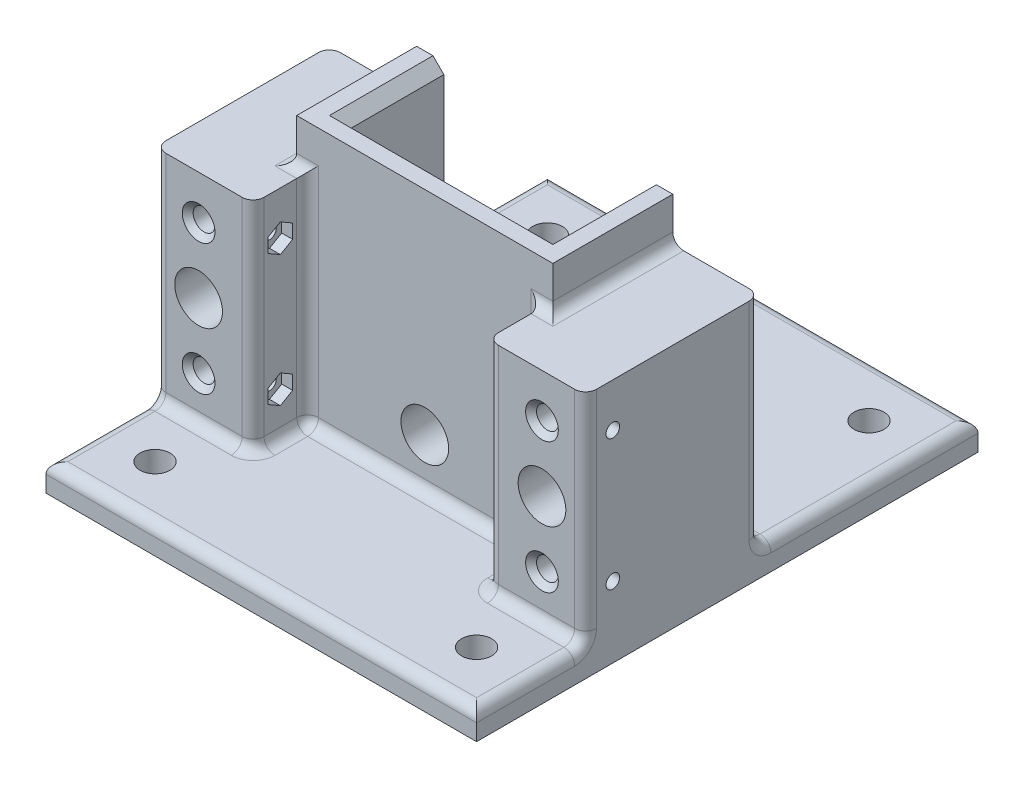
from build123d import *

# Parameters (mm, degrees)
EXTRUDE_1_DEPTH     = 30
SKETCH_2_W          = 10
SKETCH_2_H          = 40
EXTRUDE_2_DEPTH     = 2
SKETCH_3_W          = 32
SKETCH_3_H          = 40
EXTRUDE_3_DEPTH     = 16
SKETCH_4_R          = 4.375
CUT_EXTRUDE_1_DEPTH = 77.765877836
SKETCH_5_R          = 1.25
CUT_EXTRUDE_2_DEPTH = 59.386642308
SKETCH_6_R          = 2
CUT_EXTRUDE_3_DEPTH = 77.765877836
CUT_EXTRUDE_4_DEPTH = 2
CHAMFER_2_SIZE      = 3
CHAMFER_3_SIZE      = 1
CHAMFER_4_SIZE      = 3
EXTRUDE_4_DEPTH     = 18
SKETCH_10_R         = 4.375
CUT_EXTRUDE_5_DEPTH = 77.76587796
CHAMFER_6_SIZE      = 3
CHAMFER_7_SIZE      = 1
CHAMFER_8_SIZE      = 2
FILLET_3_R          = 2
SKETCH_12_W         = 79
SKETCH_12_H         = 72
EXTRUDE_5_DEPTH     = 5
FILLET_7_R          = 2
SKETCH_13_W         = 79
SKETCH_13_H         = 5
EXTRUDE_6_DEPTH     = 20
FILLET_10_R         = 2
FILLET_11_R         = 2
SKETCH_14_R         = 2.75
CUT_EXTRUDE_6_DEPTH = 101.583298875
CHAMFER_9_SIZE      = 1
CHAMFER_10_SIZE     = 2


with BuildPart() as part:
    # Эскиз1 → Бобышка-Вытянуть1 (new body)
    with BuildSketch(Plane(origin=(0, 0, 0), x_dir=(1, 0, 0), z_dir=(0, 1, 0))):
        Polygon((0, 0), (0, 22), (5, 22), (5, 5), (42, 5), (42, 22), (47, 22), (47, 0), align=None)
    extrude(amount=EXTRUDE_1_DEPTH)

    # Эскиз2 → Бобышка-Вытянуть2 (add)
    with BuildSketch(Plane(origin=(47, 0, 0), x_dir=(0, 0, -1), z_dir=(1, 0, 0))):
        with Locations((-5, 2)):
            Rectangle(SKETCH_2_W, SKETCH_2_H)
    extrude_2 = extrude(amount=-EXTRUDE_2_DEPTH)

    # Эскиз3 → Бобышка-Вытянуть3 (add)
    with BuildSketch(Plane(origin=(47, 0, 0), x_dir=(0, 0, -1), z_dir=(1, 0, 0))):
        with Locations((6, 2)):
            Rectangle(SKETCH_3_W, SKETCH_3_H)
    extrude_3 = extrude(amount=EXTRUDE_3_DEPTH)

    # Эскиз4 → Вырез-Вытянуть1 (cut, through all)
    with BuildSketch(Plane(origin=(0, 0, -22), x_dir=(-1, 0, 0), z_dir=(0, 0, -1))):
        with Locations((-55, 2)):
            Circle(SKETCH_4_R)
    cut_extrude_1 = extrude(amount=-CUT_EXTRUDE_1_DEPTH, mode=Mode.SUBTRACT)

    # Эскиз5 → Вырез-Вытянуть2 (cut, through all)
    with BuildSketch(Plane.ZY.offset(-45)):
        with Locations((5, 14)):
            Circle(SKETCH_5_R)
        with Locations(Location((5, -10, 0), (0, 0, 180))):
            Circle(SKETCH_5_R)
    cut_extrude_2 = extrude(amount=-CUT_EXTRUDE_2_DEPTH, mode=Mode.SUBTRACT)

    # Эскиз6 → Вырез-Вытянуть3 (cut, through all)
    with BuildSketch(Plane(origin=(0, 0, -22), x_dir=(-1, 0, 0), z_dir=(0, 0, -1))):
        with Locations((-55, 14)):
            Circle(SKETCH_6_R)
        with Locations((-55, -10)):
            Circle(SKETCH_6_R)
    cut_extrude_3 = extrude(amount=-CUT_EXTRUDE_3_DEPTH, mode=Mode.SUBTRACT)

    # Эскиз7 → Вырез-Вытянуть4 (cut)
    with BuildSketch(Plane.ZY.offset(-45)):
        Polygon((5, 11.401923789), (7.25, 12.700961894), (7.25, 15.299038106), (5, 16.598076211), (2.75, 15.299038106), (2.75, 12.700961894), align=None)
        Polygon((5, -7.401923789), (2.75, -8.700961894), (2.75, -11.299038106), (5, -12.598076211), (7.25, -11.299038106), (7.25, -8.700961894), align=None)
    cut_extrude_4 = extrude(amount=-CUT_EXTRUDE_4_DEPTH, mode=Mode.SUBTRACT)

    # Фаска2
    chamfer_2_edges = [part.edges().sort_by_distance(p)[0] for p in [
        (59.375, 2, -22),
    ]]
    chamfer(chamfer_2_edges, length=CHAMFER_2_SIZE)

    # Фаска3
    chamfer_3_edges = [part.edges().sort_by_distance(p)[0] for p in [
        (57, 14, -22),
        (57, -10, -22),
    ]]
    chamfer(chamfer_3_edges, length=CHAMFER_3_SIZE)

    # Зеркальное отражение2: Бобышка-Вытянуть2, Бобышка-Вытянуть3, Вырез-Вытянуть1, Вырез-Вытянуть2, Вырез-Вытянуть3, Вырез-Вытянуть4 across plane
    add(extrude_2.mirror(Plane(origin=(23.5, 0, 0), x_dir=(0, 0, 1), z_dir=(1, 0, 0))))
    add(extrude_3.mirror(Plane(origin=(23.5, 0, 0), x_dir=(0, 0, 1), z_dir=(1, 0, 0))))
    add(cut_extrude_1.mirror(Plane(origin=(23.5, 0, 0), x_dir=(0, 0, 1), z_dir=(1, 0, 0))), mode=Mode.SUBTRACT)
    add(cut_extrude_2.mirror(Plane(origin=(23.5, 0, 0), x_dir=(0, 0, 1), z_dir=(1, 0, 0))), mode=Mode.SUBTRACT)
    add(cut_extrude_3.mirror(Plane(origin=(23.5, 0, 0), x_dir=(0, 0, 1), z_dir=(1, 0, 0))), mode=Mode.SUBTRACT)
    add(cut_extrude_4.mirror(Plane(origin=(23.5, 0, 0), x_dir=(0, 0, 1), z_dir=(1, 0, 0))), mode=Mode.SUBTRACT)

    # Фаска4
    chamfer_4_edges = [part.edges().sort_by_distance(p)[0] for p in [
        (-12.375, 2, -22),
    ]]
    chamfer(chamfer_4_edges, length=CHAMFER_4_SIZE)

    # Эскиз9 → Бобышка-Вытянуть4 (add)
    with BuildSketch(Plane.XZ):
        Polygon((2, 0), (0, 0), (0, -22), (47, -22), (47, 0), (45, 0), align=None)
    extrude(amount=EXTRUDE_4_DEPTH)

    # Эскиз10 → Вырез-Вытянуть5 (cut, through all)
    with BuildSketch(Plane(origin=(0, 0, -22), x_dir=(-1, 0, 0), z_dir=(0, 0, -1))):
        with Locations((-23.5, -9)):
            Circle(SKETCH_10_R)
    extrude(amount=-CUT_EXTRUDE_5_DEPTH, mode=Mode.SUBTRACT)

    # Фаска6
    chamfer_6_edges = [part.edges().sort_by_distance(p)[0] for p in [
        (27.875, -9, -22),
    ]]
    chamfer(chamfer_6_edges, length=CHAMFER_6_SIZE)

    # Фаска7
    chamfer_7_edges = [part.edges().sort_by_distance(p)[0] for p in [
        (-10, 14, 10),
        (-10, -10, 10),
        (57, 14, 10),
        (57, -10, 10),
    ]]
    chamfer(chamfer_7_edges, length=CHAMFER_7_SIZE)

    # Фаска8
    chamfer_8_edges = [part.edges().sort_by_distance(p)[0] for p in [
        (5, 30, -13.5),
    ]]
    chamfer(chamfer_8_edges, length=CHAMFER_8_SIZE)

    # Скругление3
    fillet_3_edges = [part.edges().sort_by_distance(p)[0] for p in [
        (1, 22, 0),
        (2, 2, 0),
        (0, 22, -11),
        (45, 2, 0),
        (46, 22, 0),
        (47, 22, -11),
    ]]
    fillet(fillet_3_edges, radius=FILLET_3_R)

    # Эскиз12 → Бобышка-Вытянуть5 (add)
    with BuildSketch(Plane.XZ.offset(18)):
        with Locations((23.5, -26)):
            Rectangle(SKETCH_12_W, SKETCH_12_H)
    extrude(amount=EXTRUDE_5_DEPTH)

    # Скругление7
    fillet_7_edges = [part.edges().sort_by_distance(p)[0] for p in [
        (23.5, -18, -22),
    ]]
    fillet(fillet_7_edges, radius=FILLET_7_R)

    # Эскиз13 → Бобышка-Вытянуть6 (add)
    with BuildSketch(Plane.XY.offset(10)):
        with Locations((23.5, -20.5)):
            Rectangle(SKETCH_13_W, SKETCH_13_H)
    extrude(amount=EXTRUDE_6_DEPTH)

    # Скругление10
    fillet_10_edges = [part.edges().sort_by_distance(p)[0] for p in [
        (2, 2, 10),
        (2, -18, 6),
        (-16, 2, 10),
        (45, -18, 6),
        (45, 2, 10),
        (23.5, -18, 0),
        (44.414213562, -18, 0.585786438),
        (2.585786438, -18, 0.585786438),
        (-7, -18, 10),
        (54, -18, 10),
        (63, -18, 20),
        (-16, -18, 20),
        (23.5, -18, 30),
        (63, 2, 10),
    ]]
    fillet(fillet_10_edges, radius=FILLET_10_R)

    # Скругление11
    # the kernel refuses this fillet: 2 mm, written as the material it takes off along each edge
    with BuildSketch(Plane(origin=(63, -16, -22), x_dir=(-1, 0, 0), z_dir=(0, 1, 0)), Plane(origin=(63, -18, -24), x_dir=(0, -1, 0), z_dir=(0, 0, -1)), Plane(origin=(-16, -18, -67), x_dir=(0, -1, 0), z_dir=(0, 0, 1))) as fillet_11_piece_1:
        with BuildLine():
            CenterArc((FILLET_11_R, FILLET_11_R), FILLET_11_R, 180, 90)
            Line((0, FILLET_11_R), (0, 0))
            Line((0, 0), (FILLET_11_R, 0))
        make_face()
    extrude(amount=43, mode=Mode.SUBTRACT)
    with BuildSketch(Plane(origin=(-16, -16, -24), x_dir=(0, 0, 1), z_dir=(0, 1, 0))) as fillet_11_piece_2:
        with BuildLine():
            CenterArc((2 + FILLET_11_R, FILLET_11_R), FILLET_11_R, 180, 90)
            Line((2, FILLET_11_R), (2, 0))
            Line((2, 0), (2 + FILLET_11_R, 0))
        make_face()
    revolve(axis=Axis((-16, -16, -24), (1, 0, 0)), revolution_arc=90, mode=Mode.SUBTRACT)
    with BuildSketch(Plane(origin=(63, -16, -24), x_dir=(0, 0, 1), z_dir=(0, 1, 0))) as fillet_11_piece_3:
        with BuildLine():
            CenterArc((2 + FILLET_11_R, -FILLET_11_R), FILLET_11_R, 90, 90)
            Line((2, -FILLET_11_R), (2, 0))
            Line((2, 0), (2 + FILLET_11_R, 0))
        make_face()
    revolve(axis=Axis((63, -16, -24), (1, 0, 0)), revolution_arc=90, mode=Mode.SUBTRACT)
    with BuildSketch(Plane(origin=(-16, -16, -22), x_dir=(1, 0, 0), z_dir=(0, 1, 0))) as fillet_11_piece_4:
        with BuildLine():
            CenterArc((FILLET_11_R, -FILLET_11_R), FILLET_11_R, 90, 90)
            Line((0, -FILLET_11_R), (0, 0))
            Line((0, 0), (FILLET_11_R, 0))
        make_face()
    extrude(amount=43, mode=Mode.SUBTRACT)
    with BuildSketch(Plane(origin=(68, -18, -62), x_dir=(0, 0, 1), z_dir=(-1, 0, 0))) as fillet_11_piece_5:
        with BuildLine():
            CenterArc((FILLET_11_R, -FILLET_11_R), FILLET_11_R, 90, 90)
            Line((0, -FILLET_11_R), (0, 0))
            Line((0, 0), (FILLET_11_R, 0))
        make_face()
    extrude(amount=89, mode=Mode.SUBTRACT)

    # Эскиз14 → Вырез-Вытянуть6 (cut, through all)
    with BuildSketch(Plane(origin=(0, -18, 0), x_dir=(1, 0, 0), z_dir=(0, 1, 0))):
        with Locations(Location((-6, -20, 0), (0, 0, 270))):
            Circle(SKETCH_14_R)
        with Locations(Location((53, -20, 0), (0, 0, 90))):
            Circle(SKETCH_14_R)
        with Locations(Location((-6, 52, 0), (0, 0, 270))):
            Circle(SKETCH_14_R)
        with Locations(Location((53, 52, 0), (0, 0, 90))):
            Circle(SKETCH_14_R)
    extrude(amount=-CUT_EXTRUDE_6_DEPTH, mode=Mode.SUBTRACT)

    # Фаска9
    chamfer_9_edges = [part.edges().sort_by_distance(p)[0] for p in [
        (-10, 14, -22),
        (-10, -10, -22),
    ]]
    chamfer(chamfer_9_edges, length=CHAMFER_9_SIZE)

    # Фаска10
    chamfer_10_edges = [part.edges().sort_by_distance(p)[0] for p in [
        (42, 30, -13.5),
        (22.5, 30, -5),
    ]]
    chamfer(chamfer_10_edges, length=CHAMFER_10_SIZE)


solid = part.part
